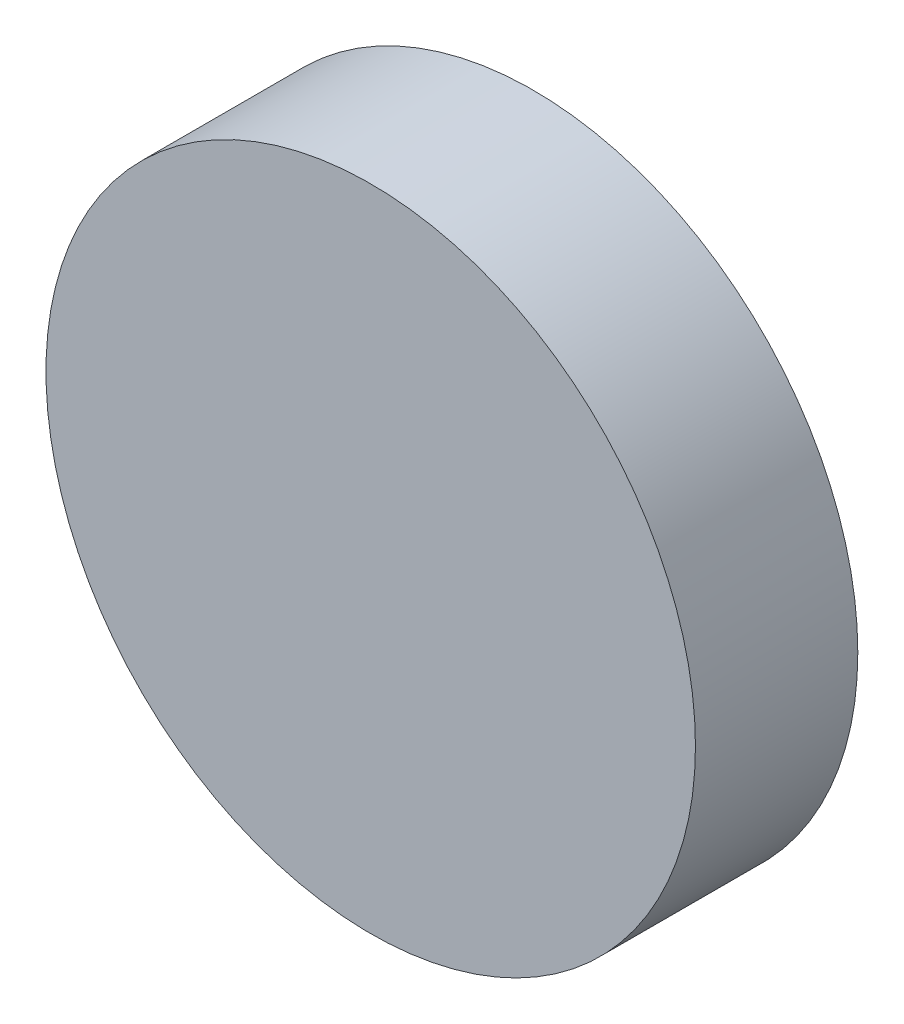
from build123d import *

# Parameters (mm, degrees)
SKETCH1_R           = 1.25
BOSS_EXTRUDE1_DEPTH = 2.5
SKETCH2_R           = 5
BOSS_EXTRUDE2_DEPTH = 2.5
SCALE1_SCALE        = 0.33


with BuildPart() as part:
    # Sketch1 → Boss-Extrude1 (new body)
    with BuildSketch(Plane.XY):
        Circle(SKETCH1_R)
    extrude(amount=BOSS_EXTRUDE1_DEPTH)

    # Sketch2 → Boss-Extrude2 (add)
    with BuildSketch(Plane.XY.offset(2.5)):
        Circle(SKETCH2_R)
    extrude(amount=BOSS_EXTRUDE2_DEPTH)


with BuildPart() as part_1:
    # Scale1: scaled about (0, 0, 3.602941176)
    add(part.part.scale(SCALE1_SCALE).moved(Location((0, 0, 2.413970588))))


solid = part_1.part
